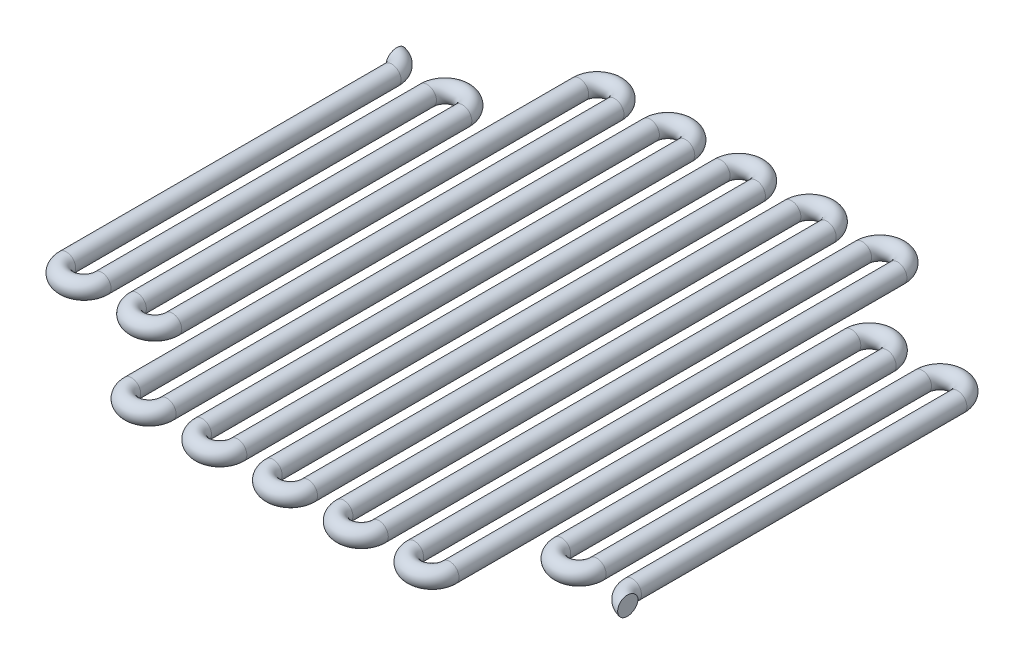
from build123d import *

# Parameters (mm, degrees)
SKETCH74_R              = 1.00000054
CUT_EXTRUDE4_DEPTH      = 46.649838811
CUT_EXTRUDE4_DEPTH_BACK = 46.649838811
SKETCH71_W              = 73.76617856
SKETCH71_H              = 63.5
SKETCH71_W_2            = 50.974683991


with BuildPart() as part:
    # Sweep4: sweep along a path in Sketch73
    with BuildLine(Plane(origin=(0, 0, 0), x_dir=(1, 0, 0), z_dir=(0, 1, 0))) as sweep4_path:
        ThreePointArc((-34.29, 17.253948776), (-32.385, 19.158948776), (-30.48, 17.253948776))
        Line((-30.48, 17.253948776), (-30.48, -17.807552249))
        ThreePointArc((-30.48, -17.807552249), (-28.575, -19.712552249), (-26.67, -17.807552249))
        Line((-26.67, -17.807552249), (-26.67, 17.253948776))
        ThreePointArc((-26.67, 17.253948776), (-24.765, 19.158948776), (-22.86, 17.253948776))
        Line((-22.86, 17.253948776), (-22.86, -17.807552249))
        ThreePointArc((-22.86, -17.807552249), (-20.955, -19.712552249), (-19.05, -17.807552249))
        Line((-19.05, -17.807552249), (-19.05, 26.035))
        ThreePointArc((-19.05, 26.035), (-17.145, 27.94), (-15.24, 26.035))
        Line((-15.24, 26.035), (-15.24, -26.035))
        ThreePointArc((-15.24, -26.035), (-13.335, -27.94), (-11.43, -26.035))
        Line((-11.43, -26.035), (-11.43, 26.035))
        ThreePointArc((-11.43, 26.035), (-9.525, 27.94), (-7.62, 26.035))
        Line((-7.62, 26.035), (-7.62, -26.035))
        ThreePointArc((-7.62, -26.035), (-5.715, -27.94), (-3.81, -26.035))
        Line((-3.81, -26.035), (-3.81, 26.035))
        ThreePointArc((-3.81, 26.035), (-1.905, 27.94), (0, 26.035))
        Line((0, 26.035), (0, -26.035))
        ThreePointArc((0, -26.035), (1.905, -27.94), (3.81, -26.035))
        Line((3.81, -26.035), (3.81, 26.035))
        ThreePointArc((3.81, 26.035), (5.715, 27.94), (7.62, 26.035))
        Line((7.62, 26.035), (7.62, -26.035))
        ThreePointArc((7.62, -26.035), (9.525, -27.94), (11.43, -26.035))
        Line((11.43, -26.035), (11.43, 26.035))
        ThreePointArc((11.43, 26.035), (13.335, 27.94), (15.24, 26.035))
        Line((15.24, 26.035), (15.24, -26.035))
        ThreePointArc((15.24, -26.035), (17.145, -27.94), (19.05, -26.035))
        Line((19.05, -26.035), (19.05, 17.253948776))
        ThreePointArc((19.05, 17.253948776), (20.955, 19.158948776), (22.86, 17.253948776))
        Line((22.86, 17.253948776), (22.86, -17.807552249))
        ThreePointArc((22.86, -17.807552249), (24.765, -19.712552249), (26.67, -17.807552249))
        Line((26.67, -17.807552249), (26.67, 17.253948776))
        ThreePointArc((26.67, 17.253948776), (28.575, 19.158948776), (30.48, 17.253948776))
        Line((30.48, 17.253948776), (30.48, -17.807552249))
        ThreePointArc((30.48, -17.807552249), (32.385, -19.712552249), (34.29, -17.807552249))
    # Sketch74 → Sweep4 (sweep)
    with BuildSketch(Plane.XY):
        Circle(SKETCH74_R)
    sweep(path=sweep4_path.line)

    # Sketch71 → Cut-Extrude4 (cut, two sides: drawn at the far end of the back side and taken through both)
    with BuildSketch(Plane(origin=(0, 0, 0), x_dir=(1, 0, 0), z_dir=(0, 1, 0)).offset(-CUT_EXTRUDE4_DEPTH_BACK)):
        with Locations((68.63308928, 0)):
            Rectangle(SKETCH71_W, SKETCH71_H)
        with Locations((-57.237341996, 0)):
            Rectangle(SKETCH71_W_2, SKETCH71_H)
    extrude(amount=CUT_EXTRUDE4_DEPTH + CUT_EXTRUDE4_DEPTH_BACK, mode=Mode.SUBTRACT)


solid = part.part
